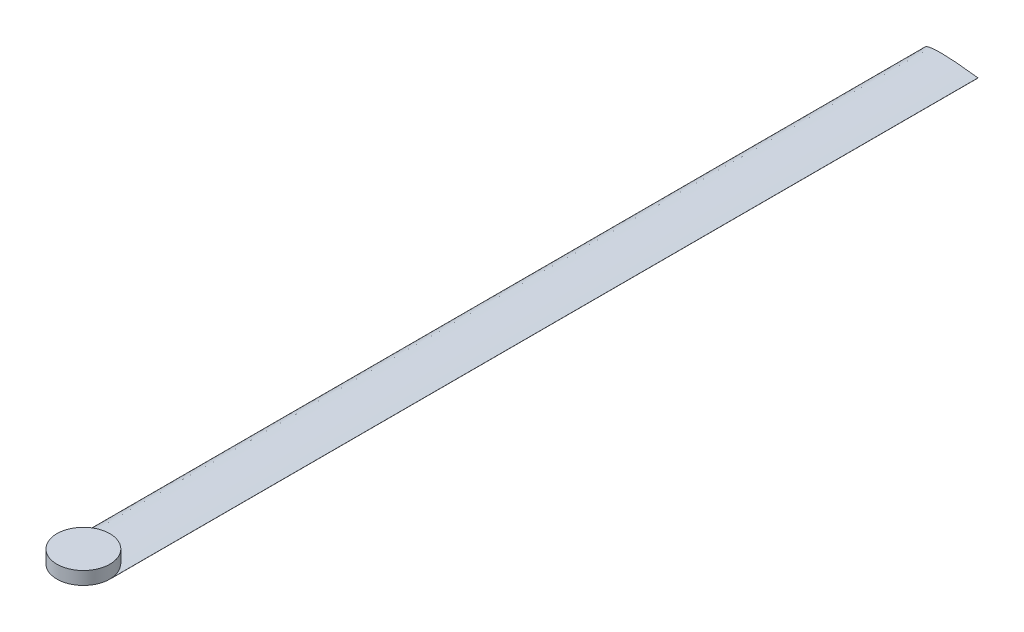
from build123d import *

# Parameters (mm, degrees)
VTAIL_EXTRUDE_DEPTH = 850.9
MOUNT_R             = 25.962293135
MOUNT_EXTRUDE_DEPTH = 12.7


with BuildPart() as part:
    # vtail → vtail_extrude (new body)
    with BuildSketch(Plane.XY):
        with BuildLine():
            Line((51.92458627, 0.065424979), (51.92458627, -0.065424979))
            add(Edge.make_bspline(
                [(51.92458627, 0.065424979), (51.914478354, 0.066844748), (51.874083016, 0.072518723), (51.712863774, 0.095066772), (51.471523301, 0.128771261), (51.150559029, 0.173034789), (50.672957766, 0.238699258), (50.118515758, 0.313734293), (49.488548455, 0.397767262), (48.932928494, 0.470958754), (48.323662112, 0.550211077), (47.662159652, 0.63488808), (46.680421251, 0.758797339), (45.63440863, 0.887388607), (44.526542008, 1.020022448), (43.629400255, 1.125356801), (42.690965601, 1.233179149), (41.713483205, 1.343214132), (40.699205332, 1.45467241), (39.65053303, 1.567254629), (38.56987444, 1.680156257), (37.459776894, 1.793168073), (36.322819428, 1.905418631), (35.161675349, 2.016555379), (33.979041045, 2.125806426), (32.777675311, 2.232814587), (31.56039134, 2.336695242), (30.330025888, 2.436983744), (29.089468087, 2.533039634), (27.841599483, 2.624091823), (26.589352622, 2.709569241), (25.335650695, 2.788789108), (23.259746376, 2.908472838), (20.794809758, 3.021813521), (18.352099773, 3.089097832), (16.383918278, 3.117693576), (14.852242451, 3.118848021), (13.354729119, 3.095807917), (11.93526964, 3.05732466), (10.560138238, 2.994929127), (9.233179239, 2.905328521), (8.29460829, 2.827093136), (7.397280543, 2.736777469), (6.543280967, 2.634724129), (5.734578367, 2.521347933), (4.973077852, 2.396860226), (4.260524639, 2.261883177), (3.598558656, 2.116924319), (2.988726972, 1.962475049), (2.432377125, 1.799227273), (1.930735866, 1.627723138), (1.484872972, 1.448554979), (1.095671048, 1.262239664), (0.763871576, 1.069165093), (0.489860922, 0.869658563), (0.274168548, 0.663391899), (0.117314604, 0.449780782), (0.021413855, 0.227781104), (-0.010438009, 0), (0.021413855, -0.227781104), (0.117314604, -0.449780782), (0.274168548, -0.663391899), (0.489860922, -0.869658563), (0.763871576, -1.069165093), (1.095671048, -1.262239664), (1.484872972, -1.448554979), (1.930735866, -1.627723138), (2.432377125, -1.799227273), (2.988726972, -1.962475049), (3.598558656, -2.116924319), (4.260524639, -2.261883177), (4.973077852, -2.396860226), (5.734578367, -2.521347933), (6.543280967, -2.634724129), (7.397280543, -2.736777469), (8.29460829, -2.827093136), (9.233179239, -2.905328521), (10.560138238, -2.994929127), (11.93526964, -3.05732466), (13.354729119, -3.095807917), (14.852242451, -3.118848021), (16.383918278, -3.117693576), (18.352099773, -3.089097832), (20.378118385, -3.033291262), (22.42533285, -2.946826836), (24.083395627, -2.860986346), (25.335650695, -2.788789108), (26.589352622, -2.709569241), (27.841599483, -2.624091823), (29.089468087, -2.533039634), (30.330025888, -2.436983744), (31.56039134, -2.336695242), (32.777675311, -2.232814587), (33.979041045, -2.125806426), (35.161675349, -2.016555379), (36.322819428, -1.905418631), (37.459776894, -1.793168073), (38.56987444, -1.680156257), (39.65053303, -1.567254629), (40.699205332, -1.45467241), (41.713483205, -1.343214132), (42.690965601, -1.233179149), (43.629400255, -1.125356801), (44.526542008, -1.020022448), (45.63440863, -0.887388607), (46.680421251, -0.758797339), (47.662159652, -0.63488808), (48.323662112, -0.550211077), (48.932928494, -0.470958754), (49.488548455, -0.397767262), (50.118515758, -0.313734293), (50.672957766, -0.238699258), (51.150559029, -0.173034789), (51.471523301, -0.128771261), (51.712863774, -0.095066772), (51.874083016, -0.072518723), (51.914478354, -0.066844748), (51.92458627, -0.065424979)],
                knots=[0, 0, 0, 0, 0.000289201, 0.001155766, 0.004612322, 0.007193518, 0.010335793, 0.018271612, 0.023045847, 0.028342901, 0.03415012, 0.04045376, 0.04723833, 0.062186613, 0.070313724, 0.078851908, 0.087780126, 0.097077521, 0.106722049, 0.116690868, 0.126960505, 0.137507218, 0.148306055, 0.159330765, 0.17055649, 0.181956531, 0.193504043, 0.205171367, 0.2169323, 0.228758169, 0.2406214, 0.252494936, 0.264350287, 0.299535854, 0.322404759, 0.333584032, 0.35530596, 0.365799778, 0.37601757, 0.395537659, 0.404797976, 0.413698812, 0.422221441, 0.430349273, 0.438066019, 0.445356904, 0.452209372, 0.458611567, 0.464554044, 0.47002985, 0.475034902, 0.479569141, 0.483636857, 0.487250263, 0.490431338, 0.493218828, 0.495674086, 0.497891368, 0.5, 0.502108632, 0.504325914, 0.506781172, 0.509568662, 0.512749737, 0.516363143, 0.520430859, 0.524965098, 0.52997015, 0.535445956, 0.541388433, 0.547790628, 0.554643096, 0.561933981, 0.569650727, 0.577778559, 0.586301188, 0.595202024, 0.604462341, 0.62398243, 0.634200222, 0.64469404, 0.666415968, 0.677595241, 0.700464146, 0.723839427, 0.735649713, 0.747505064, 0.7593786, 0.771241831, 0.7830677, 0.794828633, 0.806495957, 0.818043469, 0.82944351, 0.840669235, 0.851693945, 0.862492782, 0.873039495, 0.883309132, 0.893277951, 0.902922479, 0.912219874, 0.921148092, 0.929686276, 0.937813387, 0.95276167, 0.95954624, 0.96584988, 0.971657099, 0.976954153, 0.981728388, 0.989664207, 0.992806482, 0.995387678, 0.998844234, 0.999710799, 1, 1, 1, 1], degree=3))
        make_face()
    extrude(amount=-VTAIL_EXTRUDE_DEPTH)

    # mount → mount_extrude (add)
    with BuildSketch(Plane(origin=(0, 0, 0), x_dir=(1, 0, 0), z_dir=(0, 1, 0))):
        with Locations((25.962293135, 0)):
            Circle(MOUNT_R)
    extrude(amount=MOUNT_EXTRUDE_DEPTH)


solid = part.part
